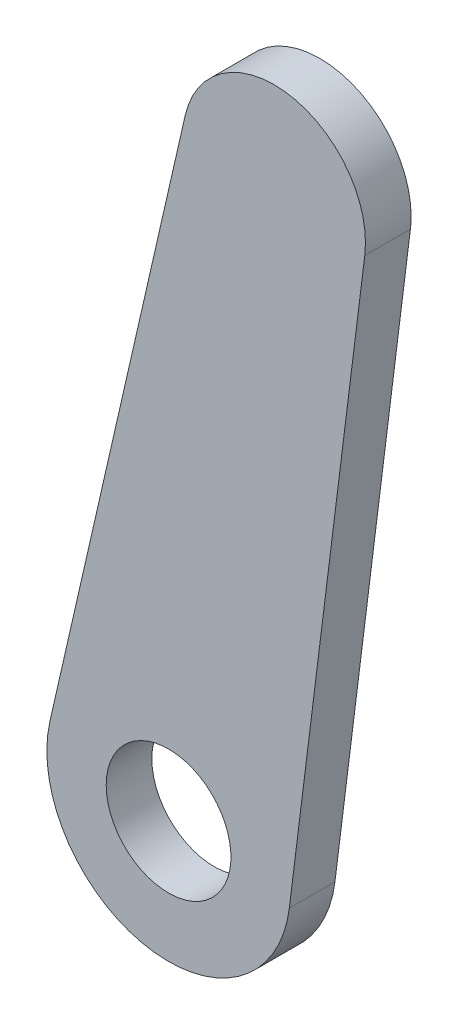
from build123d import *
from build123d.topology import SkipClean

# Parameters (mm, degrees)
SKETCH1_R           = 6
SKETCH1_R_2         = 8
BOSS_EXTRUDE1_DEPTH = 3
BOSS_EXTRUDE2_START = -2
SKETCH1_3_R         = 6
BOSS_EXTRUDE2_DEPTH = 2
SKETCH6_R           = 4.1
CUT_EXTRUDE1_DEPTH  = 3


with BuildPart() as part:
    # Sketch1 → Boss-Extrude1 (new body)
    with BuildSketch(Plane.XY):
        with BuildLine():
            ThreePointArc((12.899477, 38.647167), (5.904038, 33.483464), (1.096566, 40.728338))
            Line((1.096566, 40.728338), (-7.799149, 1.781371))
            ThreePointArc((-7.799149, 1.781371), (0.896329, 7.949629), (8, 0))
            ThreePointArc((8, 0), (7.984502, -0.497727), (7.938067, -0.993525))
            Line((7.938067, -0.993525), (12.899477, 38.647167))
        make_face()
        with Locations((6.945927, 39.39231)):
            Circle(SKETCH1_R)
        Circle(SKETCH1_R_2)
    extrude(amount=BOSS_EXTRUDE1_DEPTH)

    # Sketch1<3> → Boss-Extrude2 (add)
    with BuildSketch(Plane.XY.offset(BOSS_EXTRUDE2_START)):
        with Locations(Location((6.945927, 39.39231, 0), (0, 0, 167.134016))):
            Circle(SKETCH1_3_R)
    extrude(amount=BOSS_EXTRUDE2_DEPTH)

    # Sketch3 → Cut-Revolve1 (revolve, cut)
    with SkipClean():  # the faces are left unmerged after this step: merging them gives an invalid solid
        with BuildSketch(Plane(origin=(6.945927, 0, 0), x_dir=(0, 0, -1), z_dir=(1, 0, 0))):
            with BuildLine():
                ThreePointArc((9, 39.39231), (7.828427, 42.220737), (5, 43.39231))
                Line((5, 43.39231), (5, 35.39231))
                ThreePointArc((5, 35.39231), (7.828427, 36.563883), (9, 39.39231))
            make_face()
            with BuildLine():
                Line((5, 35.39231), (5, 43.39231))
                ThreePointArc((5, 43.39231), (1, 39.39231), (5, 35.39231))
            make_face()
        revolve(axis=Axis((6.945927, 43.39231, -5), (0, -1, 0)), mode=Mode.SUBTRACT)

    # Chamfer1: read off the stored shape, not the designer's step
    # Chamfer1 outline → Chamfer1 (revolve, cut)
    with SkipClean():  # the faces are left unmerged after this step: merging them gives an invalid solid
        with BuildSketch(Plane(origin=(6.945927, 39.39231, 0), x_dir=(1, 0, 0), z_dir=(0, -1, 0))):
            Polygon((2.601903, -1.961892), (2.601903, -2), (6, -2), (6, 0), align=None)
        revolve(axis=Axis((6.945927, 39.39231, 0), (0, 0, 1)), mode=Mode.SUBTRACT)

    # Sketch6 → Cut-Extrude1 (cut)
    with SkipClean():  # the faces are left unmerged after this step: merging them gives an invalid solid
        with BuildSketch(Plane(origin=(0, 0, 0), x_dir=(-1, 0, 0), z_dir=(0, 0, -1))):
            Circle(SKETCH6_R)
        extrude(amount=-CUT_EXTRUDE1_DEPTH, mode=Mode.SUBTRACT)


solid = part.part
